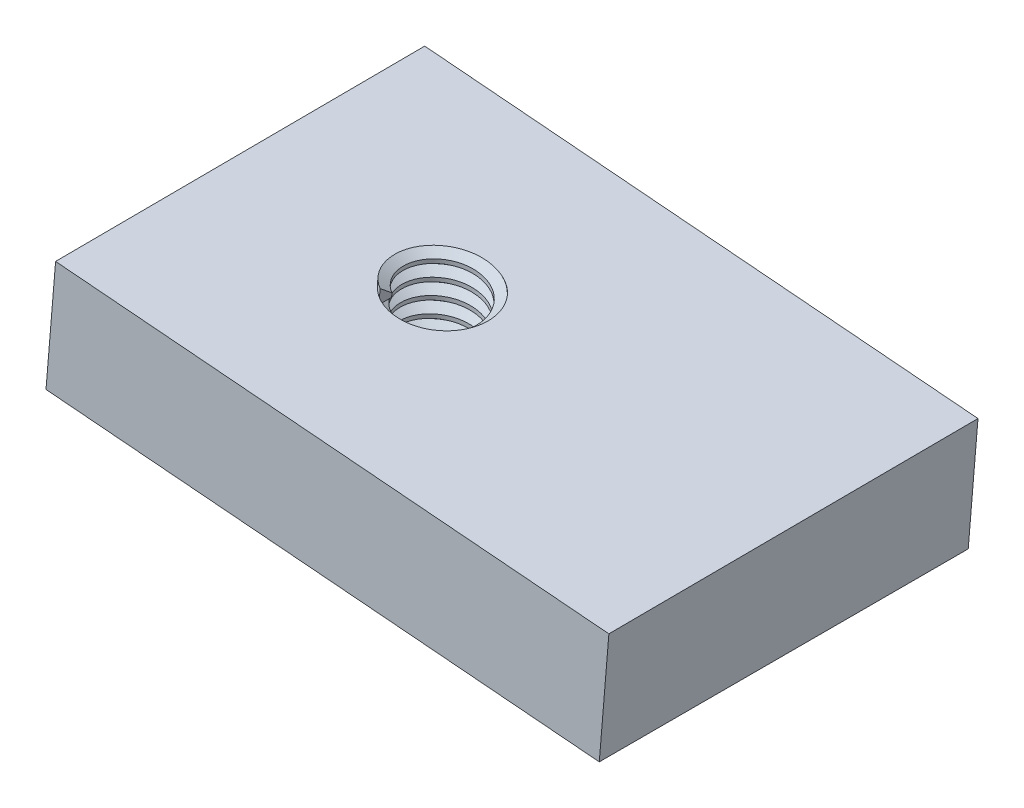
from build123d import *
from build123d.topology import SkipClean

# Parameters (mm, degrees)
SKETCH1_W                 = 15.047570974
SKETCH1_H                 = 10
BOSS_EXTRUDE1_DEPTH       = 3.203817716
DRAFT1_ANGLE              = -0.325763712
F_2_CLEARANCE_HOLE1_D     = 2.5
F_2_CLEARANCE_HOLE1_DEPTH = 4.421800182
THREAD_1_PITCH            = 0.45


with BuildPart() as part:
    # Sketch1 → Boss-Extrude1 (new body)
    with BuildSketch(Plane(origin=(-1.315367261, -15.86205167, 0), x_dir=(0.9965793195216839, -0.08264175640496577, 0), z_dir=(-0.08264175640496577, -0.9965793195216839, 0))):
        with Locations((-16.701480395, 5)):
            Rectangle(SKETCH1_W, SKETCH1_H)
    extrude(amount=-BOSS_EXTRUDE1_DEPTH)

    # Draft1
    draft1_faces = [part.faces().sort_by_distance(p)[0] for p in [
        (-17.694948105, -11.288953517, 5),
    ]]
    draft(draft1_faces, Plane(origin=(-25.192997126, -10.66717467, 0), x_dir=(-1, 0, 0), z_dir=(0, 0, -1)), DRAFT1_ANGLE)

    # #2 Clearance Hole1
    with Locations(Plane(origin=(-1.052360177, -12.690441673, 0), x_dir=(0.9965793195216839, -0.08264175640496575, 0), z_dir=(0.08264175640496575, 0.9965793195216839, 0))):
        with Locations((-18.725265882, -5)):
            Hole(F_2_CLEARANCE_HOLE1_D / 2, depth=F_2_CLEARANCE_HOLE1_DEPTH)

    # 螺纹线1: the profile of 螺纹线轮廓1 profile screwed along a right-hand helix of 6.666667 turns, 6 arcs to a turn; built about Z, then put on its axis
    with SkipClean():  # the faces are left unmerged after this step: merging them gives an invalid solid
        thread_1_z = Axis((0, 0, 0), (0, 0, 1))
        thread_1_corners = [(1.2503, 0, -0.000173205), (1.2503, 0, 0.393923204), (1.006430356, 0, 0.253124999), (1.006430356, 0, 0.140624999)]
        with BuildLine(mode=Mode.PRIVATE) as thread_1_profile:
            Line(thread_1_corners[0], thread_1_corners[1])
            Line(thread_1_corners[1], thread_1_corners[2])
            Line(thread_1_corners[2], thread_1_corners[3])
            Line(thread_1_corners[3], thread_1_corners[0])
        thread_1_cap = Face(thread_1_profile.wire())
        thread_1_turn_angles = [0, 30, 60, 90, 120, 150, 180, 210, 240, 270, 300, 330, 360]
        thread_1_turn_weights = [1, 0.8660254037844387, 1, 0.8660254037844387, 1, 0.8660254037844387, 1, 0.8660254037844387, 1, 0.8660254037844387, 1, 0.8660254037844387, 1]
        thread_1_turn_rails = [Edge.make_bspline([Vector(p[0], p[1], 0).rotate(thread_1_z, thread_1_turn_angles[k]) / thread_1_turn_weights[k] + Vector(0, 0, p[2] + THREAD_1_PITCH * thread_1_turn_angles[k] / 360) for k in range(13)], [0, 0, 0, 1, 1, 2, 2, 3, 3, 4, 4, 5, 5, 6, 6, 6], 2, thread_1_turn_weights) for p in thread_1_corners]
        thread_1_turn_sides = [Face.make_surface_from_curves(thread_1_turn_rails[p[0]], thread_1_turn_rails[p[1]]) for p in [(0, 1), (1, 2), (2, 3), (3, 0)]]
        thread_1_last_angles = [2160, 2190, 2220, 2250, 2280, 2310, 2340, 2370, 2400]
        thread_1_last_weights = [1, 0.8660254037844387, 1, 0.8660254037844387, 1, 0.8660254037844387, 1, 0.8660254037844367, 1]
        thread_1_last_rails = [Edge.make_bspline([Vector(p[0], p[1], 0).rotate(thread_1_z, thread_1_last_angles[k]) / thread_1_last_weights[k] + Vector(0, 0, p[2] + THREAD_1_PITCH * thread_1_last_angles[k] / 360) for k in range(9)], [0, 0, 0, 1, 1, 2, 2, 3, 3, 4, 4, 4], 2, thread_1_last_weights) for p in thread_1_corners]
        thread_1_last_sides = [Face.make_surface_from_curves(thread_1_last_rails[p[0]], thread_1_last_rails[p[1]]) for p in [(0, 1), (1, 2), (2, 3), (3, 0)]]
        thread_1 = Plane(origin=(-19.976579992, -14.314562809, 5), x_dir=(0.99657932, -0.082641756, 0), z_dir=(0.082641756, 0.99657932, 0)) * Solid(Shell([*[p.moved(Location((0, 0, THREAD_1_PITCH * i))) for i in range(6) for p in thread_1_turn_sides], *thread_1_last_sides, thread_1_cap, thread_1_cap.rotate(thread_1_z, 2400).moved(Location((0, 0, THREAD_1_PITCH * 2400 / 360)))]))
        add(thread_1)


solid = part.part
